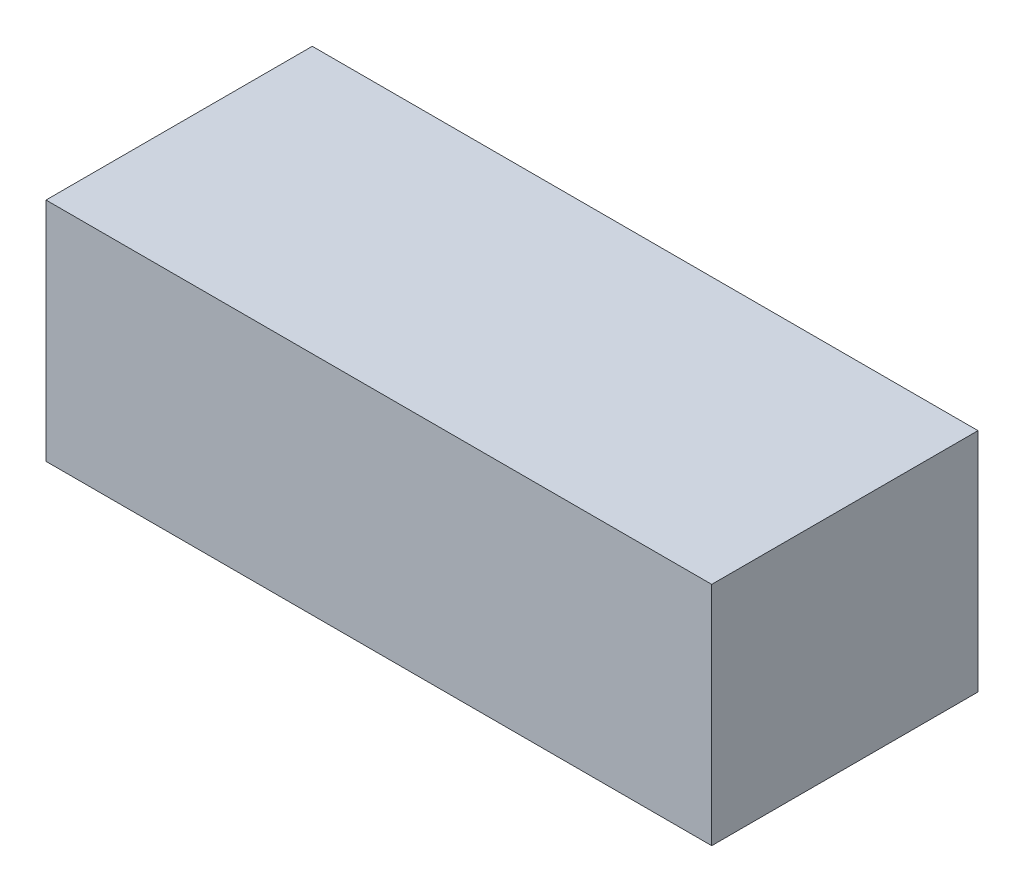
from build123d import *

# Parameters (mm, degrees)
SKETCH1_W           = 50
SKETCH1_H           = 20
BOSS_EXTRUDE1_DEPTH = 17


with BuildPart() as part:
    # Sketch1 → Boss-Extrude1 (new body)
    with BuildSketch(Plane(origin=(0, 0, 0), x_dir=(1, 0, 0), z_dir=(0, 1, 0))):
        Rectangle(SKETCH1_W, SKETCH1_H)
    extrude(amount=BOSS_EXTRUDE1_DEPTH)


solid = part.part
